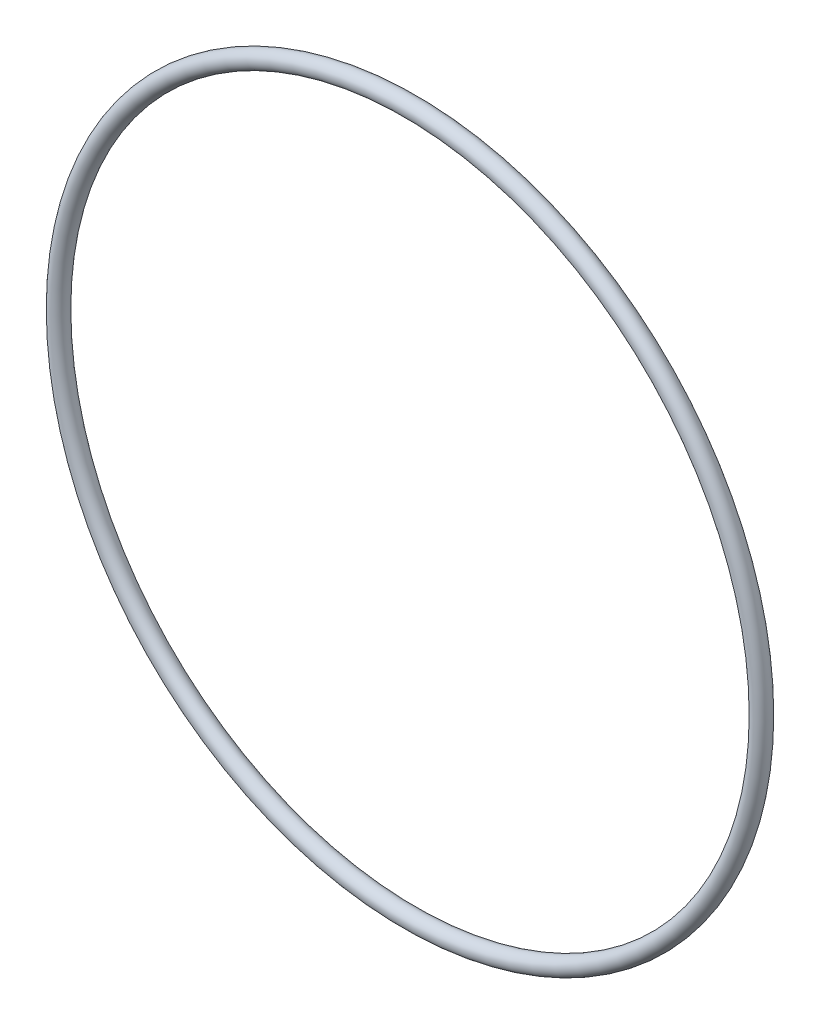
from build123d import *

# Parameters (mm, degrees)
SKETCH1_R = 1.7653


with BuildPart() as part:
    # Sketch1 → Revolve1 (revolve)
    with BuildSketch(Plane(origin=(0, 0, 0), x_dir=(0, -1, 0), z_dir=(1, 0, 0))):
        with Locations((71.4121, 0)):
            Circle(SKETCH1_R)
    revolve(axis=Axis((0, 0, 1.7653), (0, 0, -1)))


solid = part.part
